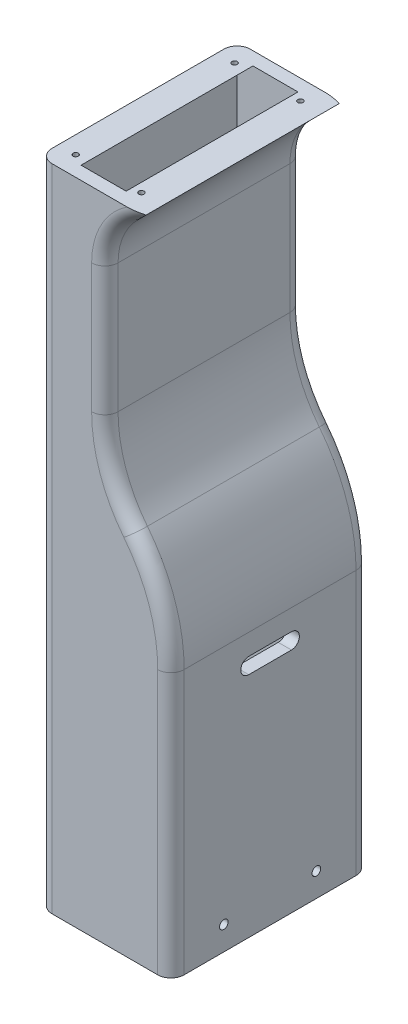
from build123d import *

# Parameters (mm, degrees)
BOSS_EXTRUDE1_DEPTH = 150
FILLET1_R           = 10
SHELL1_START        = 10
SHELL1_DEPTH        = 130
CUT_EXTRUDE1_REACH  = 525.454
CUT_EXTRUDE2_REACH  = 525.454
SKETCH3_W           = 130
SKETCH3_H           = 190
CUT_EXTRUDE3_REACH  = 523.636
SKETCH5_R           = 3.25
SKETCH6_R           = 2
BOSS_EXTRUDE2_DEPTH = 85
CUT_EXTRUDE4_REACH  = 525.454
BOSS_EXTRUDE3_REACH = 522.676
SKETCH9_W           = 10.749668542
SKETCH9_H           = 9.117335181
SKETCH10_R          = 2
CUT_EXTRUDE6_DEPTH  = 5
SKETCH11_R          = 1.5
CUT_EXTRUDE7_DEPTH  = 5


# Read off the part's stored shape, not the designer's step: Shell1
with BuildPart() as part:
    # Sketch1 → Boss-Extrude1 (new body)
    with BuildSketch(Plane.XY):
        with BuildLine():
            Line((0, 200), (0, 491.430499628))
            Line((0, 491.430499628), (100, 491.430499628))
            ThreePointArc((100, 491.430499628), (64.644660941, 476.785838687), (50, 441.430499628))
            Line((50, 441.430499628), (50, 343.917255306))
            ThreePointArc((50, 343.917255306), (55.711486428, 310.074107136), (72.213286827, 279.979749876))
            ThreePointArc((72.213286827, 279.979749876), (92.855472654, 242.334565721), (100, 200))
            Line((100, 200), (100, 0))
            Line((100, 0), (0, 0))
            Line((0, 0), (0, 200))
        make_face()
    extrude(amount=BOSS_EXTRUDE1_DEPTH)

    # Fillet1
    fillet1_edges = [part.edges().sort_by_distance(p)[0] for p in [
        (64.644660941, 476.785838687, 0),
        (50, 392.673877467, 0),
        (55.711486428, 310.074107136, 0),
        (92.855472654, 242.334565721, 0),
        (100, 100, 0),
        (100, 100, 150),
        (92.855472654, 242.334565721, 150),
        (55.711486428, 310.074107136, 150),
        (50, 392.673877467, 150),
        (64.644660941, 476.785838687, 150),
        (0, 245.715249814, 150),
        (0, 245.715249814, 0),
    ]]
    fillet(fillet1_edges, radius=FILLET1_R)

    # Shell1 outline → Shell1 (cut)
    with BuildSketch(Plane.XY.offset(SHELL1_START)):
        with BuildLine():
            Line((10, 10), (90, 10))
            Line((90, 10), (90, 200))
            ThreePointArc((90, 200), (83.409320496, 239.052766003), (64.367328706, 273.779673977))
            ThreePointArc((64.367328706, 273.779673977), (46.265334269, 306.792307417), (40, 343.917255306))
            Line((40, 343.917255306), (40, 441.430499628))
            ThreePointArc((40, 441.430499628), (47.132359263, 469.803242937), (66.833752096, 491.430499628))
            Line((66.833752096, 491.430499628), (10, 491.430499628))
            Line((10, 491.430499628), (10, 10))
        make_face()
    extrude(amount=SHELL1_DEPTH, mode=Mode.SUBTRACT)

    # Sketch2 → Cut-Extrude1 (cut, up to next)
    with BuildSketch(Plane(origin=(100, 0, 0), x_dir=(0, 0, -1), z_dir=(1, 0, 0)), mode=Mode.PRIVATE) as cut_extrude1_sk1:
        with BuildLine():
            Line((-91.151768807, 184.227304536), (-58.848231193, 184.227304536))
            ThreePointArc((-58.848231193, 184.227304536), (-52.848231193, 178.227304536), (-58.848231193, 172.227304536))
            Line((-58.848231193, 172.227304536), (-91.151768807, 172.227304536))
            ThreePointArc((-91.151768807, 172.227304536), (-97.151768807, 178.227304536), (-91.151768807, 184.227304536))
        make_face()
    cut_extrude1_tool1 = extrude(cut_extrude1_sk1.sketch, amount=-CUT_EXTRUDE1_REACH, mode=Mode.PRIVATE) & part.part
    add(cut_extrude1_tool1.solids().sort_by_distance((100, 178.227305, 75))[0], mode=Mode.SUBTRACT)

    # Sketch3 → Cut-Extrude2 (cut, up to next)
    with BuildSketch(Plane.ZY, mode=Mode.PRIVATE) as cut_extrude2_sk1:
        with Locations((75, 105)):
            Rectangle(SKETCH3_W, SKETCH3_H)
    cut_extrude2_tool1 = extrude(cut_extrude2_sk1.sketch, amount=-CUT_EXTRUDE2_REACH, mode=Mode.PRIVATE) & part.part
    add(cut_extrude2_tool1.solids().sort_by_distance((0, 105, 75))[0], mode=Mode.SUBTRACT)

    # Sketch5 → Cut-Extrude3 (cut, up to next)
    with BuildSketch(Plane.ZY.offset(-90), mode=Mode.PRIVATE) as cut_extrude3_sk1:
        with Locations((40, 18)):
            Circle(SKETCH5_R)
    cut_extrude3_tool1 = extrude(cut_extrude3_sk1.sketch, amount=-CUT_EXTRUDE3_REACH, mode=Mode.PRIVATE) & part.part
    # Sketch5 → Cut-Extrude3 (cut, up to next)
    with BuildSketch(Plane.ZY.offset(-90), mode=Mode.PRIVATE) as cut_extrude3_sk2:
        with Locations((110, 18)):
            Circle(SKETCH5_R)
    cut_extrude3_tool2 = extrude(cut_extrude3_sk2.sketch, amount=-CUT_EXTRUDE3_REACH, mode=Mode.PRIVATE) & part.part
    add(cut_extrude3_tool1.solids().sort_by_distance((90, 18, 40))[0], mode=Mode.SUBTRACT)
    add(cut_extrude3_tool2.solids().sort_by_distance((90, 18, 110))[0], mode=Mode.SUBTRACT)

    # Sketch6 → Boss-Extrude2 (add)
    # profile 1 of 4: a face of its own
    with BuildSketch(Plane.ZY.offset(-90)):
        with BuildLine():
            Line((10, 200), (10, 188))
            ThreePointArc((10, 188), (18.485281374, 191.514718626), (22, 200))
            Line((22, 200), (10, 200))
        make_face()
        with Locations((14.732857766, 195.683462966)):
            Circle(SKETCH6_R, mode=Mode.SUBTRACT)
    # profile 2 of 4: a face of its own
    with BuildSketch(Plane.ZY.offset(-90)):
        with BuildLine():
            Line((140, 200), (140, 188))
            ThreePointArc((140, 188), (131.514718626, 191.514718626), (128, 200))
            Line((128, 200), (140, 200))
        make_face()
        with Locations(Location((135.267142234, 195.683462966, 0), (0, 0, 180))):
            Circle(SKETCH6_R, mode=Mode.SUBTRACT)
    # profile 3 of 4: a face of its own
    with BuildSketch(Plane.ZY.offset(-90)):
        with BuildLine():
            Line((140, 10), (128, 10))
            ThreePointArc((128, 10), (131.514718626, 18.485281374), (140, 22))
            Line((140, 22), (140, 10))
        make_face()
        with Locations((135.267142234, 14.316537034)):
            Circle(SKETCH6_R, mode=Mode.SUBTRACT)
    # profile 4 of 4: a face of its own
    with BuildSketch(Plane.ZY.offset(-90)):
        with BuildLine():
            Line((10, 10), (22, 10))
            ThreePointArc((22, 10), (18.485281374, 18.485281374), (10, 22))
            Line((10, 22), (10, 10))
        make_face()
        with Locations(Location((14.732857766, 14.316537034, 0), (0, 0, 180))):
            Circle(SKETCH6_R, mode=Mode.SUBTRACT)
    extrude(amount=BOSS_EXTRUDE2_DEPTH)

    # Sketch8 → Cut-Extrude4 (cut, up to next)
    with BuildSketch(Plane(origin=(0, 0, 0), x_dir=(-1, 0, 0), z_dir=(0, 0, -1)), mode=Mode.PRIVATE) as cut_extrude4_sk1:
        Polygon((-64.644660941, 476.785838687), (-79.289321881, 491.430499628), (-115.095354781, 491.430499628), align=None)
    cut_extrude4_tool1 = extrude(cut_extrude4_sk1.sketch, amount=-CUT_EXTRUDE4_REACH, mode=Mode.PRIVATE) & part.part
    add(cut_extrude4_tool1.solids().sort_by_distance((86.343113, 486.548946, 0))[0], mode=Mode.SUBTRACT)

    # Sketch9 → Boss-Extrude3 (add, up to next)
    with BuildSketch(Plane.XY.offset(10), mode=Mode.PRIVATE) as boss_extrude3_sk1:
        Polygon((22.020157431, 491.430499628), (10, 480.807276536), (10, 491.430499628), align=None)
    boss_extrude3_tool1 = extrude(boss_extrude3_sk1.sketch, amount=BOSS_EXTRUDE3_REACH, mode=Mode.PRIVATE) - part.part
    # Sketch9 → Boss-Extrude3 (add, up to next)
    with BuildSketch(Plane.XY.offset(10), mode=Mode.PRIVATE) as boss_extrude3_sk2:
        with Locations((61.458917825, 486.871832037)):
            Rectangle(SKETCH9_W, SKETCH9_H)
    boss_extrude3_tool2 = extrude(boss_extrude3_sk2.sketch, amount=BOSS_EXTRUDE3_REACH, mode=Mode.PRIVATE) - part.part
    add(boss_extrude3_tool1.solids().sort_by_distance((14.006719, 487.889425, 10))[0])
    add(boss_extrude3_tool2.solids().sort_by_distance((61.458918, 486.871832, 10))[0])

    # Sketch10 → Cut-Extrude6 (cut)
    with BuildSketch(Plane(origin=(0, 491.430499628, 0), x_dir=(1, 0, 0), z_dir=(0, 1, 0))):
        with Locations(Location((13.117335181, -15, 0), (0, 0, 270))):
            Circle(SKETCH10_R)
        with Locations(Location((62.947163257, -15.024173332, 0), (0, 0, 270))):
            Circle(SKETCH10_R)
        with Locations(Location((62.860866202, -135.163680398, 0), (0, 0, 270))):
            Circle(SKETCH10_R)
        with Locations(Location((13.087879919, -135.163680398, 0), (0, 0, 270))):
            Circle(SKETCH10_R)
    extrude(amount=-CUT_EXTRUDE6_DEPTH, mode=Mode.SUBTRACT)

    # Sketch11 → Cut-Extrude7 (cut)
    with BuildSketch(Plane.ZY.offset(-90)):
        with Locations((87.434890577, 190.781669354)):
            Circle(SKETCH11_R)
        with Locations((63.434890577, 190.449058246)):
            Circle(SKETCH11_R)
        with Locations((63.767501685, 166.449058246)):
            Circle(SKETCH11_R)
        with Locations((87.767501685, 166.781669354)):
            Circle(SKETCH11_R)
    extrude(amount=-CUT_EXTRUDE7_DEPTH, mode=Mode.SUBTRACT)


solid = part.part
